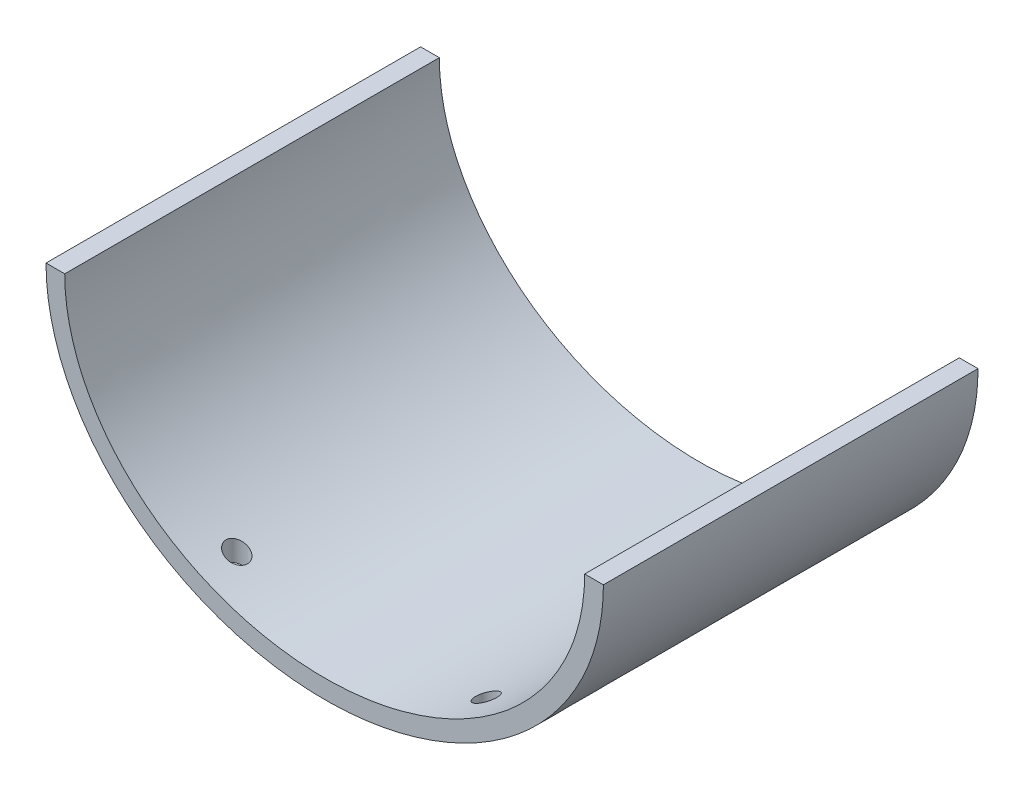
from build123d import *

# Parameters (mm, degrees)
SKETCH18_R         = 2.1844
CUT_EXTRUDE1_DEPTH = 314.841780485


with BuildPart() as part:
    # Loft1: read off the stored shape, not the designer's step
    # Loft1: loft between two sections, ruled curve by curve
    loft1_from = [
        Edge.make_bspline([(56.833832956, 0, -228.6), (56.833832956, -24.296302856, -228.6), (37.93302454, -48.592605712, -228.6), (-37.670209127, -48.592605712, -228.6), (-56.571017544, -24.296302856, -228.6), (-56.571017544, 0, -228.6)], [0, 0, 0, 0, 0.5, 0.5, 1, 1, 1, 1], 3, [1, 0.666666667, 0.5, 0.5, 0.666666667, 1]),
        Edge.make_bspline([(-52.761017544, 0, -228.6), (-52.761017544, -4.747279447, -228.6), (-51.402770393, -11.806188932, -228.6), (-45.595697561, -23.613386766, -228.6), (-39.795169121, -29.862955228, -228.6), (-30.718583767, -36.674634262, -228.6), (-20.272155915, -42.261246959, -228.6), (-8.609583282, -44.495586175, -228.6), (5.258963144, -45.021190556, -228.6), (17.65948625, -43.279675379, -228.6), (30.464702909, -37.058928058, -228.6), (38.535712181, -31.060250812, -228.6), (44.862969288, -24.583491802, -228.6), (51.190783343, -13.941223772, -228.6), (53.023832956, -5.077291503, -228.6), (53.023832956, 0, -228.6)], [0, 0, 0, 0, 0.092670327, 0.138032037, 0.255929417, 0.255929417, 0.359592664, 0.484831486, 0.484831486, 0.630530284, 0.725178151, 0.760432961, 0.82657985, 0.900919869, 1, 1, 1, 1], 3),
        Edge.make_bspline([(53.023832956, 0, -228.6), (53.658832956, 0, -228.6), (54.293832956, 0, -228.6), (55.563832956, 0, -228.6), (56.198832956, 0, -228.6), (56.833832956, 0, -228.6)], [0, 0, 0, 0, 0.5, 0.5, 1, 1, 1, 1], 3),
        Edge.make_line((-52.761017544, 0, -228.6), (-56.571017544, 0, -228.6)),
    ]
    loft1_to = [
        Edge.make_bspline([(56.854039108, 0.001519688, -304.8), (56.855077905, -28.463722616, -304.8), (33.368424055, -48.592160594, -304.8), (-33.063422969, -48.593050818, -304.8), (-56.550811364, -28.465242318, -304.8), (-56.550811364, 0, -304.8)], [0, 0, 0, 0, 0.5, 0.5, 1, 1, 1, 1], 3, [1, 0.647597082, 0.521143499, 0.521143499, 0.647597082, 1]),
        Edge.make_bspline([(-52.740811364, 0, -304.8), (-52.740749216, -4.747279446, -304.8), (-51.382409655, -11.80617115, -304.8), (-45.575182253, -23.613292961, -304.8), (-39.774571999, -29.862785486, -304.8), (-30.697897472, -36.674345695, -304.8), (-20.251396485, -42.260821635, -304.8), (-8.588794603, -44.495008174, -304.8), (5.279758702, -45.020430998, -304.8), (17.680259009, -43.278753482, -304.8), (30.485394229, -37.057838525, -304.8), (38.556324971, -31.059055621, -304.8), (44.883497288, -24.582213779, -304.8), (51.211172022, -13.939862911, -304.8), (53.044105595, -5.075906646, -304.8), (53.044039127, 0.001384857, -304.8)], [0, 0, 0, 0, 0.092670327, 0.138032037, 0.255929417, 0.255929417, 0.359592664, 0.484831486, 0.484831486, 0.630530284, 0.725178151, 0.760432961, 0.82657985, 0.900919869, 1, 1, 1, 1], 3),
        Edge.make_bspline([(53.044039127, 0.001384857, -304.8), (53.679039124, 0.001407329, -304.8), (54.31403912, 0.001429801, -304.8), (55.584039114, 0.001474744, -304.8), (56.219039111, 0.001497216, -304.8), (56.854039108, 0.001519688, -304.8)], [0, 0, 0, 0, 0.5, 0.5, 1, 1, 1, 1], 3),
        Edge.make_line((-52.740811364, 0, -304.8), (-56.550811364, 0, -304.8)),
    ]
    loft1 = Solid(Shell([*[Face.make_surface_from_curves(loft1_from[k], loft1_to[k]) for k in range(4)], Face(Wire(loft1_from)), Face(Wire(loft1_to))]))
    add(loft1)

    # Sketch18 → Cut-Extrude1 (cut, through all)
    with BuildSketch(Plane(origin=(0, 0, 0), x_dir=(1, 0, 0), z_dir=(0, 1, 0))):
        with Locations(Location((25.383246846, 236.22, 0), (0, 0, 270))):
            Circle(SKETCH18_R)
        with Locations(Location((-25.416737266, 236.260177413, 0), (0, 0, 270))):
            Circle(SKETCH18_R)
    extrude(amount=-CUT_EXTRUDE1_DEPTH, mode=Mode.SUBTRACT)


solid = part.part
